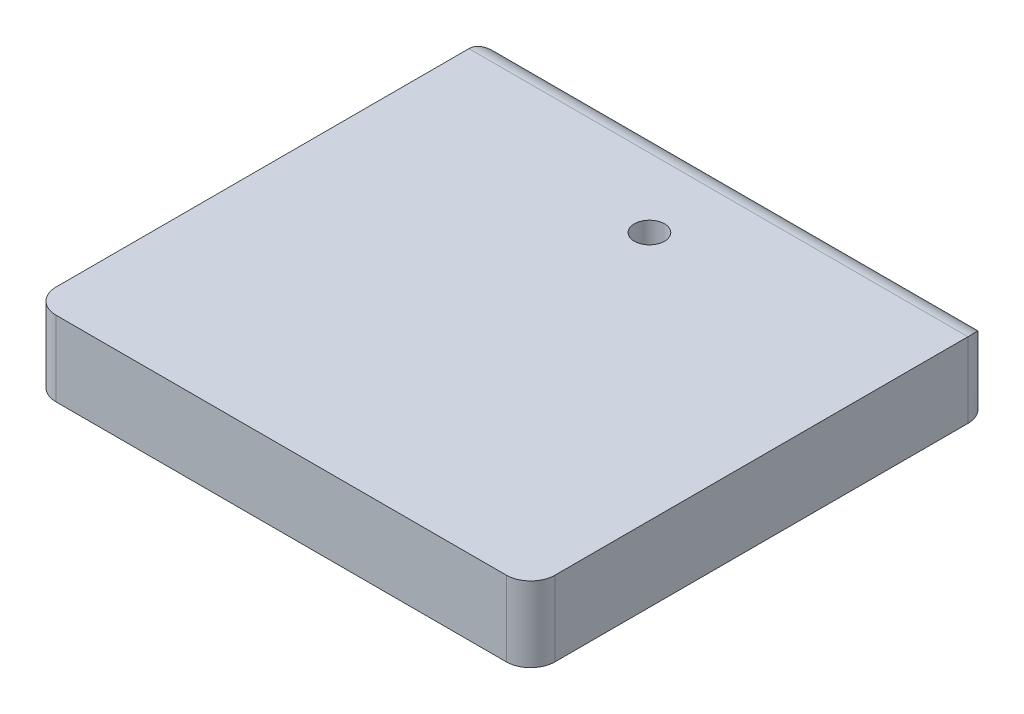
from build123d import *

# Parameters (mm, degrees)
SKETCH1_W           = 51.9684
SKETCH1_H           = 48.0822
BOSS_EXTRUDE1_DEPTH = 7.8232
FILLET1_R           = 2.54
FILLET2_R           = 2.54
SKETCH3_R           = 1.5748
CUT_EXTRUDE1_DEPTH  = 72.230716785


with BuildPart() as part:
    # Sketch1 → Boss-Extrude1 (new body)
    with BuildSketch(Plane(origin=(0, 0, 0), x_dir=(1, 0, 0), z_dir=(0, 1, 0))):
        with Locations((25.9842, 24.0411)):
            Rectangle(SKETCH1_W, SKETCH1_H)
    extrude(amount=BOSS_EXTRUDE1_DEPTH)

    # Fillet1
    fillet1_edges = [part.edges().sort_by_distance(p)[0] for p in [
        (0, 3.9116, -48.0822),
        (51.9684, 3.9116, -48.0822),
        (51.9684, 3.9116, 0),
        (0, 3.9116, 0),
    ]]
    fillet(fillet1_edges, radius=FILLET1_R)

    # Fillet2
    # the kernel refuses this fillet: 2.54 mm, written as the material it takes off along each edge
    with BuildSketch(Plane(origin=(55.7784, 7.8232, -48.0822), x_dir=(0, 0, 1), z_dir=(-1, 0, 0))) as fillet2_piece_1:
        with BuildLine():
            CenterArc((FILLET2_R, -FILLET2_R), FILLET2_R, 90, 90)
            Line((0, -FILLET2_R), (0, 0))
            Line((0, 0), (FILLET2_R, 0))
        make_face()
    extrude(amount=59.5884, mode=Mode.SUBTRACT)

    # Sketch3 → Cut-Extrude1 (cut, through all)
    with BuildSketch(Plane(origin=(0, 7.8232, 0), x_dir=(1, 0, 0), z_dir=(0, 1, 0))):
        with Locations(Location((25.9842, 38.354, 0), (0, 0, 270))):
            Circle(SKETCH3_R)
    extrude(amount=-CUT_EXTRUDE1_DEPTH, mode=Mode.SUBTRACT)


solid = part.part
